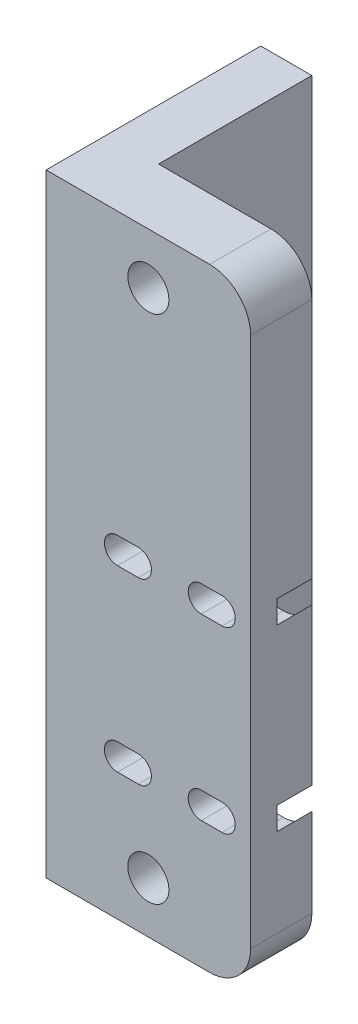
from build123d import *

# Parameters (mm, degrees)
SKETCH1_W                                     = 25.4
SKETCH1_H                                     = 76.2
BOSS_EXTRUDE1_DEPTH                           = 7.62
F_10_CLEARANCE_HOLE1_D                        = 5.1054
F_10_CLEARANCE_HOLE1_DEPTH                    = 25.4
F_10_CLEARANCE_HOLE1_TIP                      = 1.533816902
CBORE_SLOT_FOR_4_SOCKET_HEAD_CAP_SCREW1_DEPTH = 4.318
CBORE_START                                   = 4.318
CBORE_SLOT_FOR_4_SOCKET_HEAD_CAP_SC_3_DEPTH   = 3.302
FILLET1_R                                     = 5.08
SKETCH8_W                                     = 6.35
SKETCH8_H                                     = 76.2
BOSS_EXTRUDE2_DEPTH                           = 19.05


# Read off the part's stored shape, not the designer's step: CBORE SLOT for #4 Socket Head Cap Screw1
with BuildPart() as part:
    # Sketch1 → Boss-Extrude1 (new body)
    with BuildSketch(Plane.XY):
        Rectangle(SKETCH1_W, SKETCH1_H)
    extrude(amount=BOSS_EXTRUDE1_DEPTH)

    # #10 Clearance Hole1
    with Locations(Plane.XY.offset(7.62)):
        with Locations((0, 31.75), (0, -31.75)):
            Hole(F_10_CLEARANCE_HOLE1_D / 2, depth=F_10_CLEARANCE_HOLE1_DEPTH)
            with Locations((0, 0, -(F_10_CLEARANCE_HOLE1_DEPTH + F_10_CLEARANCE_HOLE1_TIP / 2))):  # 118° drill point
                Cone(0, F_10_CLEARANCE_HOLE1_D / 2, F_10_CLEARANCE_HOLE1_TIP, mode=Mode.SUBTRACT)

    # CBORE SLOT for _4 Socket Head Cap Sc 2 → CBORE SLOT for #4 Socket Head Cap Screw1 (cut)
    with BuildSketch(Plane.XY):
        with BuildLine():
            Line((12.7, -22.053863194), (12.7, -19.221136806))
            ThreePointArc((12.7, -19.221136806), (11.298437111, -17.48215186), (9.16305, -16.8275))
            Line((9.16305, -16.8275), (6.58495, -16.8275))
            ThreePointArc((6.58495, -16.8275), (2.77495, -20.6375), (6.58495, -24.4475))
            Line((6.58495, -24.4475), (9.16305, -24.4475))
            ThreePointArc((9.16305, -24.4475), (11.298437111, -23.79284814), (12.7, -22.053863194))
        make_face()
        with BuildLine():
            ThreePointArc((12.7, 3.003863194), (11.298437111, 4.74284814), (9.16305, 5.3975))
            Line((9.16305, 5.3975), (6.58495, 5.3975))
            ThreePointArc((6.58495, 5.3975), (2.77495, 1.5875), (6.58495, -2.2225))
            Line((6.58495, -2.2225), (9.16305, -2.2225))
            ThreePointArc((9.16305, -2.2225), (11.298437111, -1.56784814), (12.7, 0.171136806))
            Line((12.7, 0.171136806), (12.7, 3.003863194))
        make_face()
        with BuildLine():
            ThreePointArc((-3.82905, 5.3975), (-7.63905, 1.5875), (-3.82905, -2.2225))
            Line((-3.82905, -2.2225), (-1.25095, -2.2225))
            ThreePointArc((-1.25095, -2.2225), (2.55905, 1.5875), (-1.25095, 5.3975))
            Line((-1.25095, 5.3975), (-3.82905, 5.3975))
        make_face()
        with BuildLine():
            ThreePointArc((-3.82905, -16.8275), (-7.63905, -20.6375), (-3.82905, -24.4475))
            Line((-3.82905, -24.4475), (-1.25095, -24.4475))
            ThreePointArc((-1.25095, -24.4475), (2.55905, -20.6375), (-1.25095, -16.8275))
            Line((-1.25095, -16.8275), (-3.82905, -16.8275))
        make_face()
    extrude(amount=CBORE_SLOT_FOR_4_SOCKET_HEAD_CAP_SCREW1_DEPTH, mode=Mode.SUBTRACT)

    # CBORE SLOT for _4 Socket Head Cap Sc 3 o → CBORE SLOT for _4 Socket Head Cap Sc 3 (cut)
    with BuildSketch(Plane.XY.offset(CBORE_START)):
        with BuildLine():
            ThreePointArc((9.16305, -0.04445), (10.795, 1.5875), (9.16305, 3.21945))
            Line((9.16305, 3.21945), (6.58495, 3.21945))
            ThreePointArc((6.58495, 3.21945), (4.953, 1.5875), (6.58495, -0.04445))
            Line((6.58495, -0.04445), (9.16305, -0.04445))
        make_face()
        with BuildLine():
            ThreePointArc((-3.82905, 3.21945), (-5.461, 1.5875), (-3.82905, -0.04445))
            Line((-3.82905, -0.04445), (-1.25095, -0.04445))
            ThreePointArc((-1.25095, -0.04445), (0.381, 1.5875), (-1.25095, 3.21945))
            Line((-1.25095, 3.21945), (-3.82905, 3.21945))
        make_face()
        with BuildLine():
            ThreePointArc((9.16305, -22.26945), (10.795, -20.6375), (9.16305, -19.00555))
            Line((9.16305, -19.00555), (6.58495, -19.00555))
            ThreePointArc((6.58495, -19.00555), (4.953, -20.6375), (6.58495, -22.26945))
            Line((6.58495, -22.26945), (9.16305, -22.26945))
        make_face()
        with BuildLine():
            ThreePointArc((-3.82905, -19.00555), (-5.461, -20.6375), (-3.82905, -22.26945))
            Line((-3.82905, -22.26945), (-1.25095, -22.26945))
            ThreePointArc((-1.25095, -22.26945), (0.381, -20.6375), (-1.25095, -19.00555))
            Line((-1.25095, -19.00555), (-3.82905, -19.00555))
        make_face()
    extrude(amount=CBORE_SLOT_FOR_4_SOCKET_HEAD_CAP_SC_3_DEPTH, mode=Mode.SUBTRACT)

    # Fillet1
    fillet1_edges = [part.edges().sort_by_distance(p)[0] for p in [
        (12.7, 38.1, 3.81),
        (12.7, -38.1, 3.81),
    ]]
    fillet(fillet1_edges, radius=FILLET1_R)

    # Sketch8 → Boss-Extrude2 (add)
    with BuildSketch(Plane(origin=(0, 0, 0), x_dir=(-1, 0, 0), z_dir=(0, 0, -1))):
        with Locations((9.525, 0)):
            Rectangle(SKETCH8_W, SKETCH8_H)
    extrude(amount=BOSS_EXTRUDE2_DEPTH)


solid = part.part
